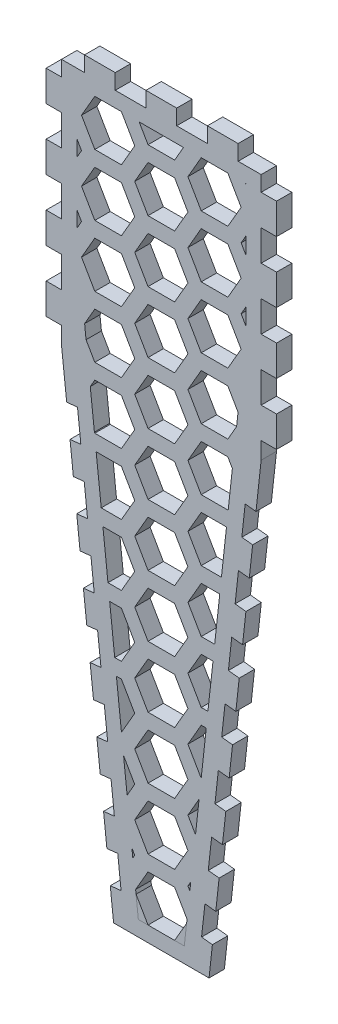
from build123d import *

# Parameters (mm, degrees)
SKETCH1_W             = 95.25
SKETCH1_H             = 304.8
BOSS_EXTRUDE1_DEPTH   = 6.35
CUT_EXTRUDE1_DEPTH    = 320.399319035
SKETCH3_W             = 6.35
SKETCH3_H             = 12.7
CUT_EXTRUDE2_DEPTH    = 320.399319035
SKETCH4_W             = 9.525
SKETCH4_H             = 6.35
SKETCH4_W_2           = 12.7
CUT_EXTRUDE3_DEPTH    = 320.399319035
CUT_EXTRUDE4_DEPTH    = 320.399319035
LPATTERN2_COUNT       = 7
LPATTERN2_PITCH       = 25.4
CUT_EXTRUDE5_DEPTH    = 320.399319035
LPATTERN3_COUNT       = 7
LPATTERN3_PITCH       = 25.4
SKETCH9_W             = 6.35
SKETCH9_H             = 57.814016323
BOSS_EXTRUDE2_DEPTH   = 6.35
LPATTERN4_COUNT       = 5
LPATTERN4_PITCH       = 25.4
BOSS_EXTRUDE5_DEPTH   = 6.35
CUT_EXTRUDE8_DEPTH    = 6.35
FILL_PATTERN1_DEPTH   = 6.35
FILL_PATTERN1_2_DEPTH = 6.35
FILL_PATTERN1_3_DEPTH = 6.35
CUT_EXTRUDE9_DEPTH    = 320.399319035


with BuildPart() as part:
    # Sketch1 → Boss-Extrude1 (new body)
    with BuildSketch(Plane.XY):
        with Locations((47.625, 152.4)):
            Rectangle(SKETCH1_W, SKETCH1_H)
    extrude(amount=BOSS_EXTRUDE1_DEPTH)

    # Sketch2 → Cut-Extrude1 (cut, through all)
    with BuildSketch(Plane.XY.offset(6.35)):
        Polygon((0, 254), (27.898079092, 0), (0, 0), align=None)
        Polygon((67.351920908, 0), (95.25, 0), (95.25, 254), align=None)
    extrude(amount=-CUT_EXTRUDE1_DEPTH, mode=Mode.SUBTRACT)

    # Sketch3 → Cut-Extrude2 (cut, through all)
    with BuildSketch(Plane.XY.offset(6.35)):
        with Locations((3.175, 298.45)):
            Rectangle(SKETCH3_W, SKETCH3_H)
        with Locations((92.075, 298.45)):
            Rectangle(SKETCH3_W, SKETCH3_H)
    cut_extrude2 = extrude(amount=-CUT_EXTRUDE2_DEPTH, mode=Mode.SUBTRACT)

    # Sketch4 → Cut-Extrude3 (cut, through all)
    with BuildSketch(Plane.XY.offset(6.35)):
        with Locations((11.1125, 301.625)):
            Rectangle(SKETCH4_W, SKETCH4_H)
        with Locations((34.925, 301.625)):
            Rectangle(SKETCH4_W_2, SKETCH4_H)
        with Locations((60.325, 301.625)):
            Rectangle(SKETCH4_W_2, SKETCH4_H)
        with Locations((84.1375, 301.625)):
            Rectangle(SKETCH4_W, SKETCH4_H)
    extrude(amount=-CUT_EXTRUDE3_DEPTH, mode=Mode.SUBTRACT)

    # Sketch5 → Cut-Extrude4 (cut, through all)
    with BuildSketch(Plane.XY.offset(6.35)):
        Polygon((26.511513632, 12.624081599), (25.124948171, 25.248163198), (29.601595278, 25.739855541), (30.988160739, 13.115773942), align=None)
    cut_extrude4 = extrude(amount=-CUT_EXTRUDE4_DEPTH, mode=Mode.SUBTRACT)

    # LPattern2: Cut-Extrude4 ×7
    with Locations(*[Vector(-0.10917838270172475, 0.9940221731685042, 0) * (i * LPATTERN2_PITCH) for i in range(1, LPATTERN2_COUNT)]):
        add(cut_extrude4, mode=Mode.SUBTRACT)

    # Sketch6 → Cut-Extrude5 (cut, through all)
    with BuildSketch(Plane.XY.offset(6.35)):
        Polygon((68.738486368, 12.624081599), (70.125051829, 25.248163198), (65.648404722, 25.739855541), (64.261839261, 13.115773942), align=None)
    cut_extrude5 = extrude(amount=-CUT_EXTRUDE5_DEPTH, mode=Mode.SUBTRACT)

    # LPattern3: Cut-Extrude5 ×7
    with Locations(*[Vector(0.10917838270172495, 0.9940221731685042, 0) * (i * LPATTERN3_PITCH) for i in range(1, LPATTERN3_COUNT)]):
        add(cut_extrude5, mode=Mode.SUBTRACT)

    # Sketch9 → Boss-Extrude2 (add, through all)
    with BuildSketch(Plane.XY.offset(6.35)):
        with Locations((3.175, 225.092991839)):
            Rectangle(SKETCH9_W, SKETCH9_H)
        with Locations((92.075, 225.092991839)):
            Rectangle(SKETCH9_W, SKETCH9_H)
    extrude(amount=-BOSS_EXTRUDE2_DEPTH)

    # LPattern4: Cut-Extrude2 ×5
    with Locations(*[(0, -i * LPATTERN4_PITCH, 0) for i in range(1, LPATTERN4_COUNT)]):
        add(cut_extrude2, mode=Mode.SUBTRACT)

    # Sketch10<3> → Cut-Extrude9 (cut, through all)
    with BuildSketch(Plane.XY.offset(6.35)):
        Polygon((12.7, 292.1), (12.7, 237.783301283), (38.119466707, 6.35), (57.130533293, 6.35), (82.55, 237.783301283), (82.55, 292.1), align=None)
    extrude(amount=-CUT_EXTRUDE9_DEPTH, mode=Mode.SUBTRACT)


with BuildPart() as body_2:
    # Sketch10 → Boss-Extrude5 (new body)
    with BuildSketch(Plane.XY.offset(6.35)):
        Polygon((12.7, 292.1), (12.7, 237.783301283), (38.119466707, 6.35), (57.130533293, 6.35), (82.55, 237.783301283), (82.55, 292.1), align=None)
    extrude(amount=-BOSS_EXTRUDE5_DEPTH)

    # Sketch13 → Cut-Extrude8 (cut)
    with BuildSketch(Plane.XY.offset(6.35)):
        Polygon((53.124261314, 279.4), (42.125738686, 279.4), (36.626477372, 269.875), (42.125738686, 260.35), (53.124261314, 260.35), (58.623522628, 269.875), align=None)
    extrude(amount=-CUT_EXTRUDE8_DEPTH, mode=Mode.SUBTRACT)

    # Fill Pattern1 3 outline → Fill Pattern1 3 (cut)
    with BuildSketch(Plane.XY):
        Polygon((75.12130657, 222.25), (80.620567884, 231.775), (75.12130657, 241.3), (64.122783942, 241.3), (58.623522628, 231.775), (64.122783942, 222.25), align=None)
        Polygon((20.12869343, 222.25), (31.127216058, 222.25), (36.626477372, 231.775), (31.127216058, 241.3), (20.12869343, 241.3), (14.629432116, 231.775), align=None)
        Polygon((82.55, 292.1), (82.453654989, 292.1), (82.55, 291.933125546), align=None)
        Polygon((80.620567884, 282.575), (75.12130657, 292.1), (64.122783942, 292.1), (58.623522628, 282.575), (64.122783942, 273.05), (75.12130657, 273.05), align=None)
        Polygon((82.55, 266.533125546), (82.55, 273.216874454), (80.620567884, 269.875), align=None)
        Polygon((53.124261314, 285.75), (56.790435523, 292.1), (38.459564477, 292.1), (42.125738686, 285.75), align=None)
        Polygon((82.55, 241.133125546), (82.55, 247.816874454), (80.620567884, 244.475), align=None)
        Polygon((36.626477372, 282.575), (31.127216058, 292.1), (20.12869343, 292.1), (14.629432116, 282.575), (20.12869343, 273.05), (31.127216058, 273.05), align=None)
        Polygon((78.743101978, 203.12313366), (79.343264436, 208.58735447), (75.12130657, 215.9), (64.122783942, 215.9), (58.623522628, 206.375), (64.122783942, 196.85), (75.12130657, 196.85), align=None)
        Polygon((12.7, 291.933125546), (12.796345011, 292.1), (12.7, 292.1), align=None)
        Polygon((75.29787504, 171.75582556), (76.999360222, 187.247115656), (75.12130657, 190.5), (64.122783942, 190.5), (58.623522628, 180.975), (64.122783942, 171.45), (75.12130657, 171.45), align=None)
        Polygon((14.629432116, 269.875), (12.7, 273.216874454), (12.7, 266.533125546), align=None)
        Polygon((72.474476793, 146.05), (74.566832725, 165.1), (64.122783942, 165.1), (58.623522628, 155.575), (64.122783942, 146.05), align=None)
        Polygon((14.629432116, 244.475), (12.7, 247.816874454), (12.7, 241.133125546), align=None)
        Polygon((69.684668884, 120.65), (71.777024816, 139.7), (64.122783942, 139.7), (58.623522628, 130.175), (64.122783942, 120.65), align=None)
        Polygon((20.12869343, 215.9), (15.906735564, 208.58735447), (16.506898022, 203.12313366), (20.12869343, 196.85), (31.127216058, 196.85), (36.626477372, 206.375), (31.127216058, 215.9), align=None)
        Polygon((66.894860975, 95.25), (68.987216907, 114.3), (64.122783942, 114.3), (58.623522628, 104.775), (64.122783942, 95.25), align=None)
        Polygon((20.12869343, 190.5), (18.250639778, 187.247115656), (19.95212496, 171.75582556), (20.12869343, 171.45), (31.127216058, 171.45), (36.626477372, 180.975), (31.127216058, 190.5), align=None)
        Polygon((64.107887047, 69.87580218), (66.197408998, 88.9), (64.122783942, 88.9), (58.623522628, 79.375), align=None)
        Polygon((31.127216058, 165.1), (20.683167275, 165.1), (22.775523207, 146.05), (31.127216058, 146.05), (36.626477372, 155.575), align=None)
        Polygon((61.763982834, 48.535563366), (63.239580756, 61.970247208), (58.623522628, 53.975), align=None)
        Polygon((31.127216058, 139.7), (23.472975184, 139.7), (25.565331116, 120.65), (31.127216058, 120.65), (36.626477372, 130.175), align=None)
        Polygon((59.42007862, 27.195324552), (59.794353818, 30.602939108), (58.623522628, 28.575), align=None)
        Polygon((31.127216058, 114.3), (26.262783093, 114.3), (28.355139025, 95.25), (31.127216058, 95.25), (36.626477372, 104.775), align=None)
        Polygon((57.130533293, 6.35), (58.248126513, 16.525205145), (53.124261314, 25.4), (42.125738686, 25.4), (37.001873487, 16.525205145), (38.119466707, 6.35), align=None)
        Polygon((31.127216058, 88.9), (29.052591003, 88.9), (31.142112953, 69.87580218), (36.626477372, 79.375), align=None)
        Polygon((36.626477372, 53.975), (32.010419244, 61.970247208), (33.486017166, 48.535563366), align=None)
        Polygon((35.455646182, 30.602939108), (35.82992138, 27.195324552), (36.626477372, 28.575), align=None)
        Polygon((20.12869343, 247.65), (31.127216058, 247.65), (36.626477372, 257.175), (31.127216058, 266.7), (20.12869343, 266.7), (14.629432116, 257.175), align=None)
        Polygon((64.122783942, 266.7), (58.623522628, 257.175), (64.122783942, 247.65), (75.12130657, 247.65), (80.620567884, 257.175), (75.12130657, 266.7), align=None)
        Polygon((42.125738686, 234.95), (53.124261314, 234.95), (58.623522628, 244.475), (53.124261314, 254), (42.125738686, 254), (36.626477372, 244.475), align=None)
        Polygon((53.124261314, 203.2), (42.125738686, 203.2), (36.626477372, 193.675), (42.125738686, 184.15), (53.124261314, 184.15), (58.623522628, 193.675), align=None)
        Polygon((42.125738686, 209.55), (53.124261314, 209.55), (58.623522628, 219.075), (53.124261314, 228.6), (42.125738686, 228.6), (36.626477372, 219.075), align=None)
        Polygon((53.124261314, 177.8), (42.125738686, 177.8), (36.626477372, 168.275), (42.125738686, 158.75), (53.124261314, 158.75), (58.623522628, 168.275), align=None)
        Polygon((42.125738686, 133.35), (53.124261314, 133.35), (58.623522628, 142.875), (53.124261314, 152.4), (42.125738686, 152.4), (36.626477372, 142.875), align=None)
        Polygon((53.124261314, 127), (42.125738686, 127), (36.626477372, 117.475), (42.125738686, 107.95), (53.124261314, 107.95), (58.623522628, 117.475), align=None)
        Polygon((53.124261314, 101.6), (42.125738686, 101.6), (36.626477372, 92.075), (42.125738686, 82.55), (53.124261314, 82.55), (58.623522628, 92.075), align=None)
        Polygon((53.124261314, 76.2), (42.125738686, 76.2), (36.626477372, 66.675), (42.125738686, 57.15), (53.124261314, 57.15), (58.623522628, 66.675), align=None)
        Polygon((53.124261314, 50.8), (42.125738686, 50.8), (36.626477372, 41.275), (42.125738686, 31.75), (53.124261314, 31.75), (58.623522628, 41.275), align=None)
    extrude(amount=FILL_PATTERN1_3_DEPTH, mode=Mode.SUBTRACT)


with BuildPart() as body_3:
    # Fill Pattern1: read off the stored shape, not the designer's step
    # Fill Pattern1 outline → Fill Pattern1 (new body)
    with BuildSketch(Plane.XY):
        Polygon((37.178259651, 14.919285058), (38.119466707, 6.35), (42.125738686, 6.35), align=None)
    extrude(amount=FILL_PATTERN1_DEPTH)


with BuildPart() as body_4:
    # Fill Pattern1 2 outline → Fill Pattern1 2 (new body)
    with BuildSketch(Plane.XY):
        Polygon((58.071740349, 14.919285058), (53.124261314, 6.35), (57.130533293, 6.35), align=None)
    extrude(amount=FILL_PATTERN1_2_DEPTH)


with BuildPart() as part_1:
    add(part.part)

    # Combine1: read off the stored shape, not the designer's step
    # Combine1: union body 2
    add(body_2.part)


solid = Compound([body_3.part, body_4.part, part_1.part])
